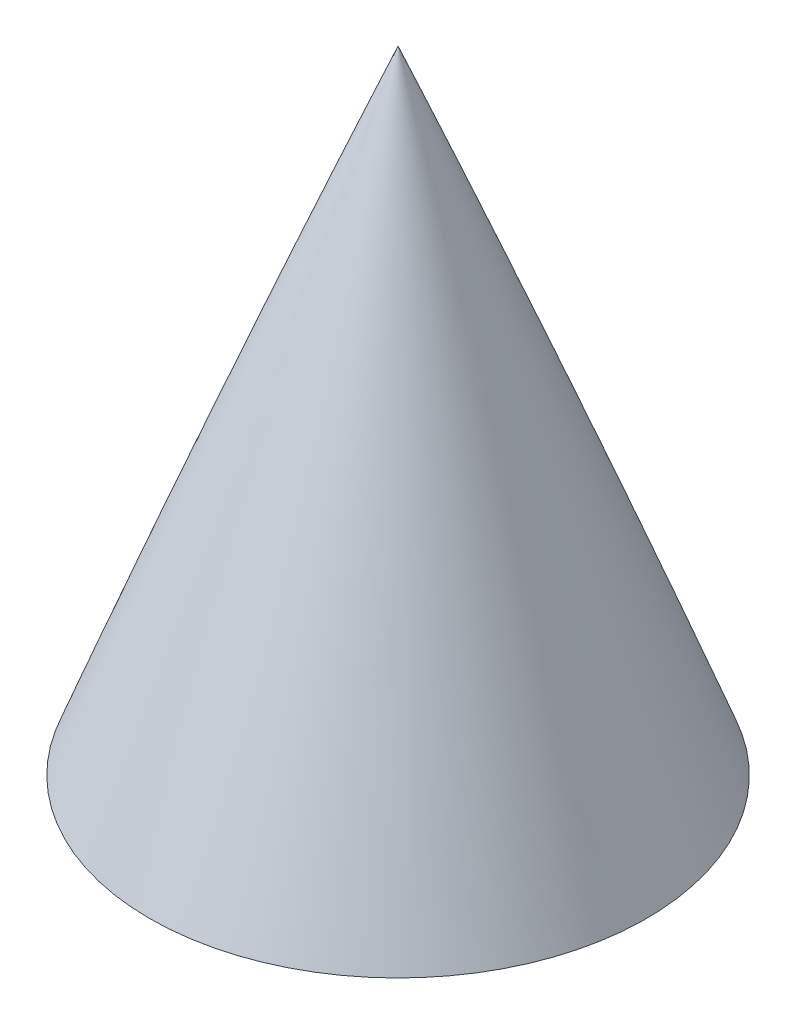
from build123d import *

# Parameters (mm, degrees)
BOSS_EXTRUDE1_REACH = 566.43
SKETCH5_R           = 78.35


# Read off the part's stored shape, not the designer's step: Shell1
with BuildPart() as part:
    # Sketch1 → Revolve3 (revolve)
    with BuildSketch(Plane.XY, mode=Mode.PRIVATE) as revolve3_sk:
        with BuildLine():
            Line((0, 400), (0, 402.756656622))
            ThreePointArc((0, 402.756656622), (60.363605816, 205.385909299), (80.75, 0))
            Line((80.75, 0), (80.75, -150))
            Line((80.75, -150), (78.35, -150))
            Line((78.35, -150), (78.35, 0))
            ThreePointArc((78.35, 0), (58.574924408, 202.078213736), (0, 396.489212171))
            Line((0, 396.489212171), (0, 400))
        make_face()
    revolve(revolve3_sk.sketch.rotate(Axis((0, 400, 0), (0, 1, 0)), 270), axis=Axis((0, 400, 0), (0, 1, 0)))


with BuildPart() as body_2:

    # Sketch5 → Boss-Extrude1 (new, up to next)
    with BuildSketch(Plane.XZ.offset(150), mode=Mode.PRIVATE) as boss_extrude1_sk1:
        with Locations(Location((0, 0, 0), (0, 0, 270))):
            Circle(SKETCH5_R)
    boss_extrude1_tool1 = extrude(boss_extrude1_sk1.sketch, amount=-BOSS_EXTRUDE1_REACH, mode=Mode.PRIVATE) - part.part
    add(boss_extrude1_tool1.solids().sort_by_distance((0, -150, 0))[0])


with BuildPart() as body_2_2:
    # Split1: the piece on the far side of the plane
    add(body_2.part)
    split(bisect_by=Plane.ZX.offset(366.489212171), keep=Keep.BOTTOM)


with BuildPart() as body_2_1:
    add(body_2.part)

    # Split1
    split(bisect_by=Plane.ZX.offset(366.489212171), keep=Keep.TOP)

    # Shell1 outline → Shell1 (revolve, cut)
    with BuildSketch(Plane.XY):
        with BuildLine():
            Line((0, 366.489212071), (8.594128749, 366.489212171))
            add(Edge.make_bspline(
                [(8.594128749, 366.489212171), (4.422525693, 377.560318323), (0, 388.533600877)],
                knots=[0.360348629, 0.360348629, 0.360348629, 0.383112862, 0.383112862, 0.383112862], degree=2, weights=[1, 0.999935224, 1]))
            Line((0, 388.533600877), (0, 366.489212071))
        make_face()
    revolve(axis=Axis((0, 0, 0), (0, 1, 0)), mode=Mode.SUBTRACT)


solid = body_2_1.part
